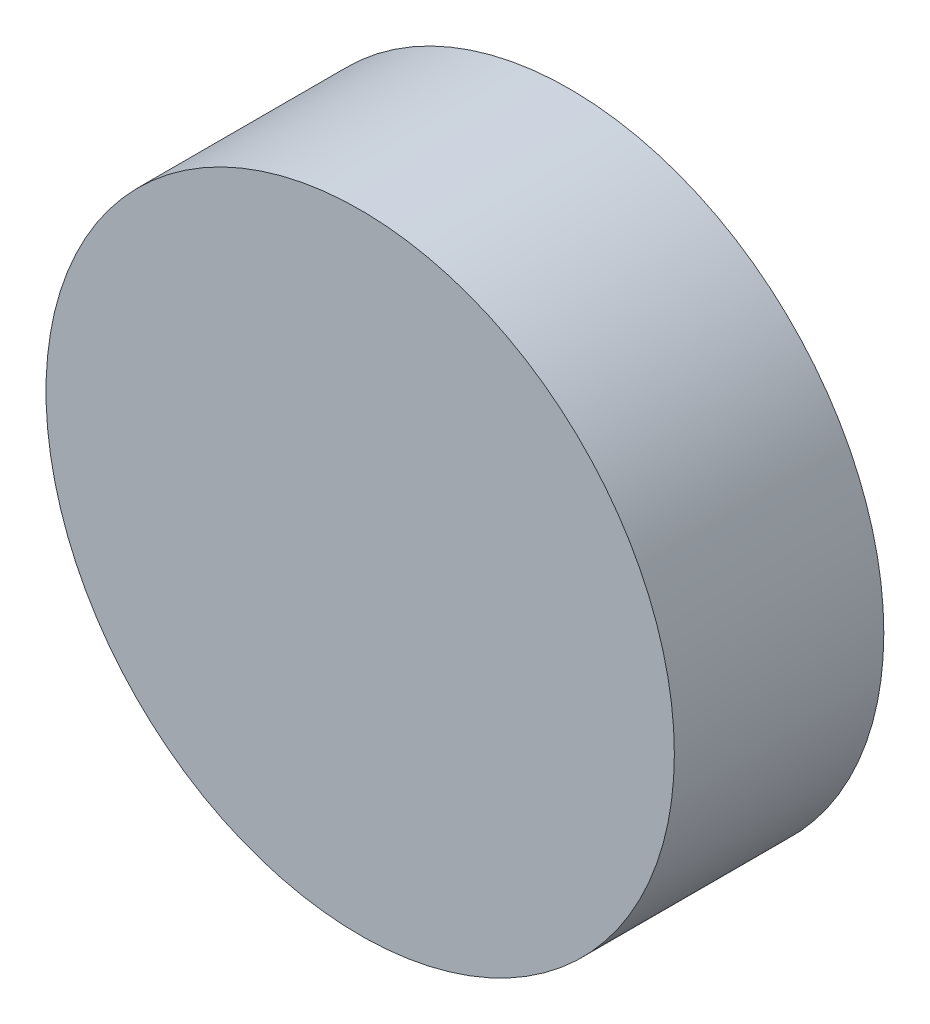
from build123d import *

# Parameters (mm, degrees)
SKETCH1_R           = 37.5
BOSS_EXTRUDE1_DEPTH = 25


with BuildPart() as part:
    # Sketch1 → Boss-Extrude1 (new body)
    with BuildSketch(Plane.XY):
        Circle(SKETCH1_R)
    extrude(amount=-BOSS_EXTRUDE1_DEPTH)


solid = part.part
